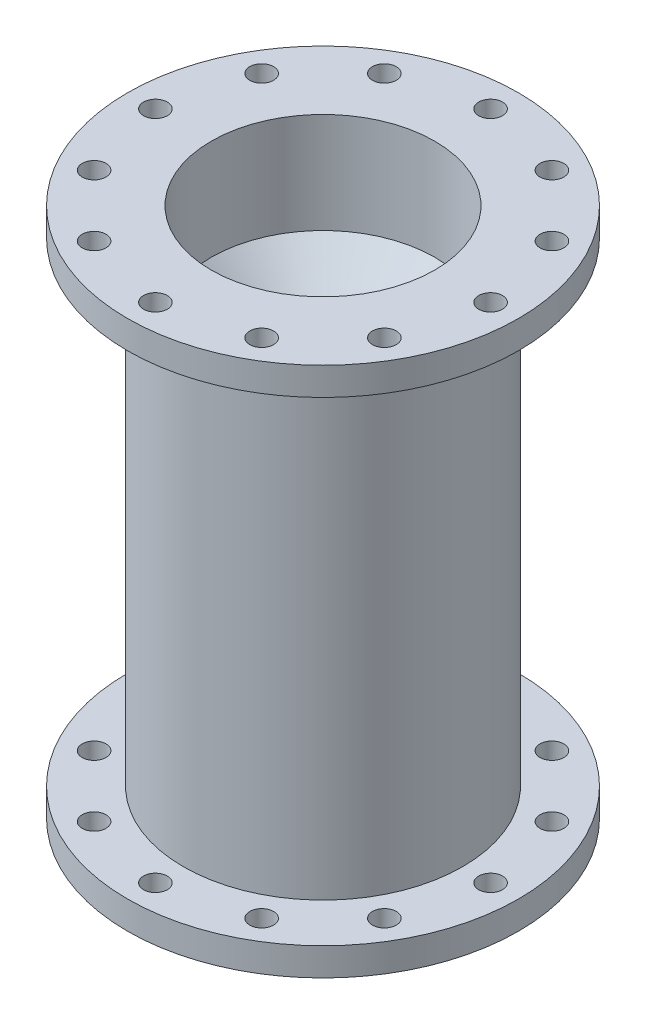
from build123d import *

# Parameters (mm, degrees)
F_3_0_213_DIAMETER_HOLE3_D = 5.4102


with BuildPart() as part:
    # Sketch1 → Chamber (revolve)
    with BuildSketch(Plane(origin=(0, 0, 0), x_dir=(0, 0, -1), z_dir=(1, 0, 0))):
        Polygon((31.75, 6.35), (31.75, 114.3), (44.45, 114.3), (44.45, 120.65), (31.75, 120.65), (25.4, 120.65), (25.4, 114.3), (25.4, 6.35), (25.4, 0), (31.75, 0), (44.45, 0), (44.45, 6.35), align=None)
    revolve(axis=Axis((0, 0, 0), (0, 1, 0)))

    # Sketch4 → Turbulence Rings (revolve)
    with BuildSketch(Plane(origin=(0, 0, 0), x_dir=(0, 0, -1), z_dir=(1, 0, 0))):
        Polygon((25.4, 95.25), (25.4, 97.79), (7.62, 80.01), (7.62, 77.47), align=None)
    revolve(axis=Axis((0, 0, 0), (0, 1, 0)))

    # #3 (0.213) Diameter Hole3 (through all)
    with Locations(Plane(origin=(0, 120.65, 0), x_dir=(1, 0, 0), z_dir=(0, 1, 0))):
        with Locations((0, 0), (-38.1, 0), (-32.995567884, 19.05), (-19.05, 32.995567884), (0, 38.1), (19.05, 32.995567884), (32.995567884, 19.05), (38.1, 0), (32.995567884, -19.05), (19.05, -32.995567884), (0, -38.1), (-19.05, -32.995567884), (-32.995567884, -19.05)):
            Hole(F_3_0_213_DIAMETER_HOLE3_D / 2)


solid = part.part
